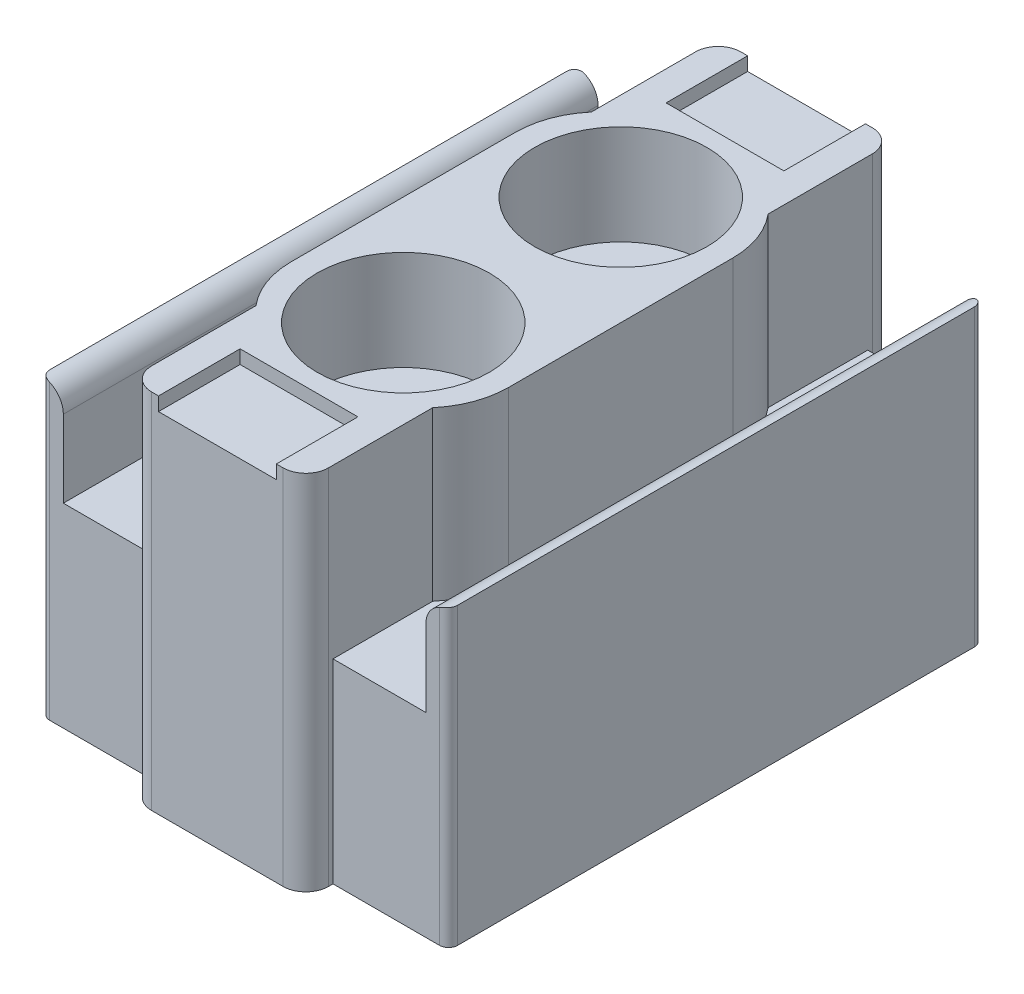
from build123d import *

# Parameters (mm, degrees)
SKETCH1_W           = 45
SKETCH1_H           = 65
BOSS_EXTRUDE1_DEPTH = 40
SKETCH2_W           = 12.75
SKETCH2_H           = 3
CUT_EXTRUDE1_DEPTH  = 40
CUT_EXTRUDE2_DEPTH  = 7.5
CUT_EXTRUDE3_DEPTH  = 18.5
SKETCH6_W           = 13
SKETCH6_H           = 23
CUT_EXTRUDE4_DEPTH  = 1.5
SKETCH7_R           = 9.5
CUT_EXTRUDE5_DEPTH  = 11
SKETCH8_R           = 1
CUT_EXTRUDE6_DEPTH  = 10
FILLET1_R           = 2.5
FILLET2_R           = 2.5
FILLET3_R           = 2.5
FILLET4_R           = 1
FILLET5_R           = 9.5


# Some blends are built 0.0001 mm under size
with BuildPart() as part:
    # Sketch1 → Boss-Extrude1 (new body)
    with BuildSketch(Plane(origin=(0, 0, 0), x_dir=(1, 0, 0), z_dir=(0, 1, 0))):
        Rectangle(SKETCH1_W, SKETCH1_H)
    extrude(amount=BOSS_EXTRUDE1_DEPTH)

    # Sketch2 → Cut-Extrude1 (cut)
    with BuildSketch(Plane(origin=(0, 40, 0), x_dir=(1, 0, 0), z_dir=(0, 1, 0))):
        with Locations((-16.125, 31)):
            Rectangle(SKETCH2_W, SKETCH2_H)
        with Locations((16.125, 31)):
            Rectangle(SKETCH2_W, SKETCH2_H)
        with Locations((-16.125, -31)):
            Rectangle(SKETCH2_W, SKETCH2_H)
        with Locations((16.125, -31)):
            Rectangle(SKETCH2_W, SKETCH2_H)
    extrude(amount=-CUT_EXTRUDE1_DEPTH, mode=Mode.SUBTRACT)

    # Sketch3 → Cut-Extrude2 (cut)
    with BuildSketch(Plane(origin=(0, 40, 0), x_dir=(1, 0, 0), z_dir=(0, 1, 0))):
        Polygon((-22.5, 29.5), (-9.75, 29.5), (-9.75, 18.5), (-12, 18.5), (-12, -18.5), (-9.75, -18.5), (-9.75, -29.5), (-22.5, -29.5), (-22.5, -18.5), (-22.5, 18.5), align=None)
        Polygon((22.5, -29.5), (9.75, -29.5), (9.75, -18.5), (12, -18.5), (12, 18.5), (9.75, 18.5), (9.75, 29.5), (22.5, 29.5), (22.5, 18.5), (22.5, -18.5), align=None)
    extrude(amount=-CUT_EXTRUDE2_DEPTH, mode=Mode.SUBTRACT)

    # Sketch5 → Cut-Extrude3 (cut)
    with BuildSketch(Plane(origin=(0, 40, 0), x_dir=(1, 0, 0), z_dir=(0, 1, 0))):
        Polygon((-20, 29.5), (-12, 29.5), (-9.75, 29.5), (-9.75, 18.5), (-12, 18.5), (-12, -18.5), (-9.75, -18.5), (-9.75, -29.5), (-12, -29.5), (-20, -29.5), align=None)
        Polygon((12, -29.5), (9.75, -29.5), (9.75, -18.5), (12, -18.5), (12, 18.5), (9.75, 18.5), (9.75, 29.5), (12, 29.5), (20, 29.5), (20, -29.5), align=None)
    extrude(amount=-CUT_EXTRUDE3_DEPTH, mode=Mode.SUBTRACT)

    # Sketch6 → Cut-Extrude4 (cut)
    with BuildSketch(Plane(origin=(0, 40, 0), x_dir=(1, 0, 0), z_dir=(0, 1, 0))):
        with Locations((0, 35)):
            Rectangle(SKETCH6_W, SKETCH6_H)
        with Locations((0, -35)):
            Rectangle(SKETCH6_W, SKETCH6_H)
    extrude(amount=-CUT_EXTRUDE4_DEPTH, mode=Mode.SUBTRACT)

    # Sketch7 → Cut-Extrude5 (cut)
    with BuildSketch(Plane(origin=(0, 40, 0), x_dir=(1, 0, 0), z_dir=(0, 1, 0))):
        with Locations(Location((0, -12, 0), (0, 0, 270))):
            Circle(SKETCH7_R)
        with Locations(Location((0, 12, 0), (0, 0, 90))):
            Circle(SKETCH7_R)
    extrude(amount=-CUT_EXTRUDE5_DEPTH, mode=Mode.SUBTRACT)

    # Sketch8 → Cut-Extrude6 (cut)
    with BuildSketch(Plane(origin=(0, 21.5, 0), x_dir=(1, 0, 0), z_dir=(0, 1, 0))):
        with Locations(Location((-16, 20, 0), (0, 0, 270))):
            Circle(SKETCH8_R)
        with Locations(Location((16, 20, 0), (0, 0, 270))):
            Circle(SKETCH8_R)
        with Locations(Location((16, -20, 0), (0, 0, 270))):
            Circle(SKETCH8_R)
        with Locations(Location((-16, -20, 0), (0, 0, 270))):
            Circle(SKETCH8_R)
    extrude(amount=-CUT_EXTRUDE6_DEPTH, mode=Mode.SUBTRACT)

    # Fillet1
    fillet1_edges = [part.edges().sort_by_distance(p)[0] for p in [
        (-20, 32.5, 0),
    ]]
    fillet(fillet1_edges, radius=FILLET1_R - 0.0001)  # a hair under: the kernel refuses the full size

    # Fillet2
    fillet2_edges = [part.edges().sort_by_distance(p)[0] for p in [
        (20, 32.5, 0),
    ]]
    fillet(fillet2_edges, radius=FILLET2_R - 0.0001)  # a hair under: the kernel refuses the full size

    # Fillet3
    fillet3_edges = [part.edges().sort_by_distance(p)[0] for p in [
        (9.75, 20, -32.5),
        (-9.75, 20, 32.5),
        (-9.75, 20, -32.5),
        (9.75, 20, 32.5),
    ]]
    fillet(fillet3_edges, radius=FILLET3_R)

    # Fillet4
    fillet4_edges = [part.edges().sort_by_distance(p)[0] for p in [
        (22.5, 16.25, -29.5),
        (-22.5, 16.25, 29.5),
        (-22.5, 16.25, -29.5),
        (22.5, 16.25, 29.5),
    ]]
    fillet(fillet4_edges, radius=FILLET4_R)

    # Fillet5
    # the kernel refuses this fillet: 9.5 mm, written as the material it takes off along each edge
    with BuildSketch(Plane(origin=(12, 55.347536447, 18.5), x_dir=(-1, 0, 0), z_dir=(0, -1, 0)), Plane(origin=(-12, 55.347536447, -18.5), x_dir=(1, 0, 0), z_dir=(0, -1, 0))) as fillet5_piece_1:
        with BuildLine():
            CenterArc((9.5, 6.139014579), FILLET5_R, 180, 40.256612576)
            Line((0, 6.139014579), (-0.19, 6.139014579))
            Line((-0.19, 6.139014579), (-0.19, 0))
            Line((-0.19, 0), (0, -0.19))
            ThreePointArc((0, -0.19), (1.125, -0.19), (2.105, -0.122780292))
            Line((2.105, -0.122780292), (2.25, 0))
        make_face()
    extrude(amount=33.847536447, mode=Mode.SUBTRACT)
    with BuildSketch(Plane(origin=(-12, 55.347536447, 18.5), x_dir=(1, 0, 0), z_dir=(0, -1, 0)), Plane(origin=(12, 55.347536447, -18.5), x_dir=(-1, 0, 0), z_dir=(0, -1, 0))) as fillet5_piece_2:
        with BuildLine():
            CenterArc((9.5, -6.139014579), FILLET5_R, 139.743387424, 40.256612576)
            Line((0, -6.139014579), (-0.19, -6.139014579))
            Line((-0.19, -6.139014579), (-0.19, 0))
            Line((-0.19, 0), (0, 0.19))
            ThreePointArc((0, 0.19), (1.125, 0.19), (2.105, 0.122780292))
            Line((2.105, 0.122780292), (2.25, 0))
        make_face()
    extrude(amount=33.847536447, mode=Mode.SUBTRACT)


solid = part.part
